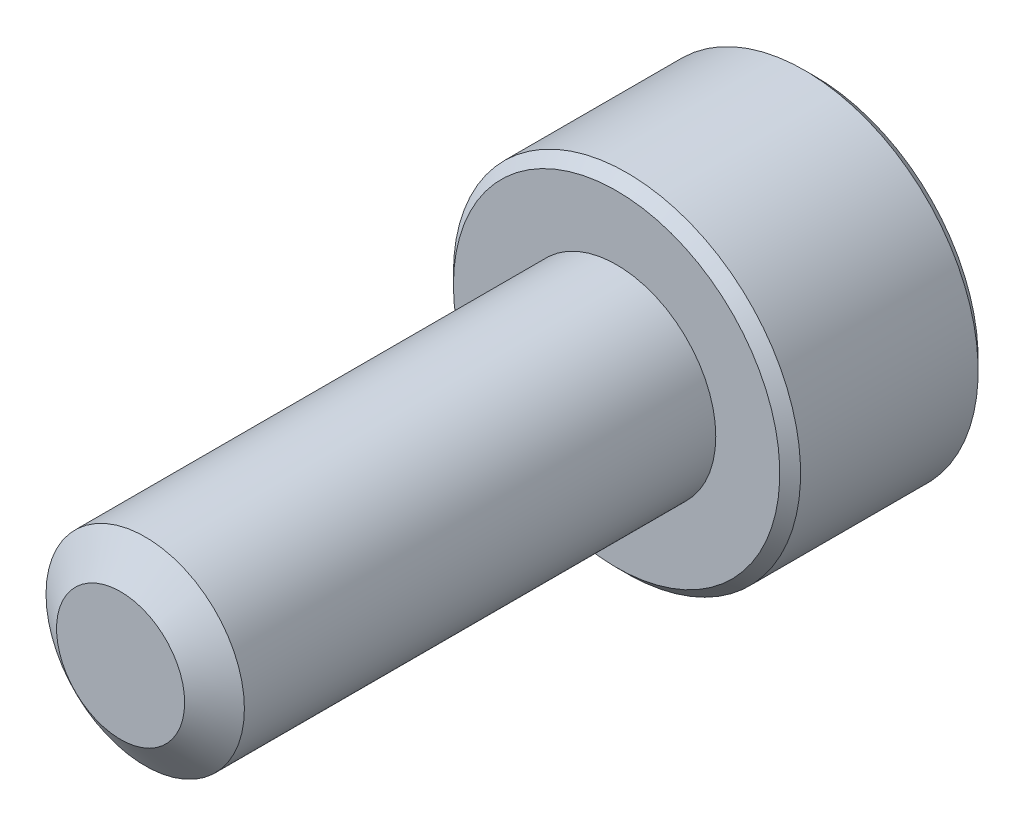
from build123d import *

# Parameters (mm, degrees)
SKETCH1_R          = 2
EXTRUDE1_DEPTH     = 10
SKETCH6_R          = 3.5
EXTRUDE2_DEPTH     = 4
CUT_EXTRUDE1_DEPTH = 2.25
CHAMFER1_SIZE      = 0.21


with BuildPart() as part:
    # Sketch1 → Extrude1 (new body)
    with BuildSketch(Plane.XY):
        Circle(SKETCH1_R)
    extrude(amount=-EXTRUDE1_DEPTH)

    # Sketch4 → Cut-Revolve1 (revolve, cut)
    with BuildSketch(Plane(origin=(0, 0, 0), x_dir=(0, 0, -1), z_dir=(1, 0, 0))):
        Polygon((0.496211411, 2), (0, 1.291336663), (0, 2), align=None)
    revolve(axis=Axis((0, 0, 0), (0, 0, -1)), mode=Mode.SUBTRACT)

    # Sketch6 → Extrude2 (add)
    with BuildSketch(Plane(origin=(0, 0, -10), x_dir=(-1, 0, 0), z_dir=(0, 0, -1))):
        Circle(SKETCH6_R)
    extrude(amount=EXTRUDE2_DEPTH)

    # Sketch7 → Cut-Extrude1 (cut)
    with BuildSketch(Plane(origin=(0, 0, -14), x_dir=(-1, 0, 0), z_dir=(0, 0, -1))):
        Polygon((0, 1.732050808), (-1.5, 0.866025404), (-1.5, -0.866025404), (0, -1.732050808), (1.5, -0.866025404), (1.5, 0.866025404), align=None)
    extrude(amount=-CUT_EXTRUDE1_DEPTH, mode=Mode.SUBTRACT)

    # Cut-Extrude2 cone 1 section (through the dimple's axis) → Cut-Extrude2 (revolve, cut)
    with BuildSketch(Plane(origin=(0, 0, -14), x_dir=(0, 1, 0), z_dir=(1, 0, 0))):
        Polygon((0, 0), (1.732050808, 0), (0, 1.732050808), align=None)
    revolve(axis=Axis((0, 0, -14), (0, 0, 1)), mode=Mode.SUBTRACT)

    # Chamfer1
    chamfer1_edges = [part.edges().sort_by_distance(p)[0] for p in [
        (3.5, 0, -14),
        (3.5, 0, -10),
    ]]
    chamfer(chamfer1_edges, length=CHAMFER1_SIZE)

    # Sketch10 → Revolve1 (revolve)
    with BuildSketch(Plane(origin=(0, 0, 0), x_dir=(0, 0, -1), z_dir=(1, 0, 0))):
        Polygon((10, 2), (10, 0), (8.996572875, 0), (9.825, 2), align=None)
    revolve(axis=Axis((0, 0, -10), (0, 0, 1)))


solid = part.part
